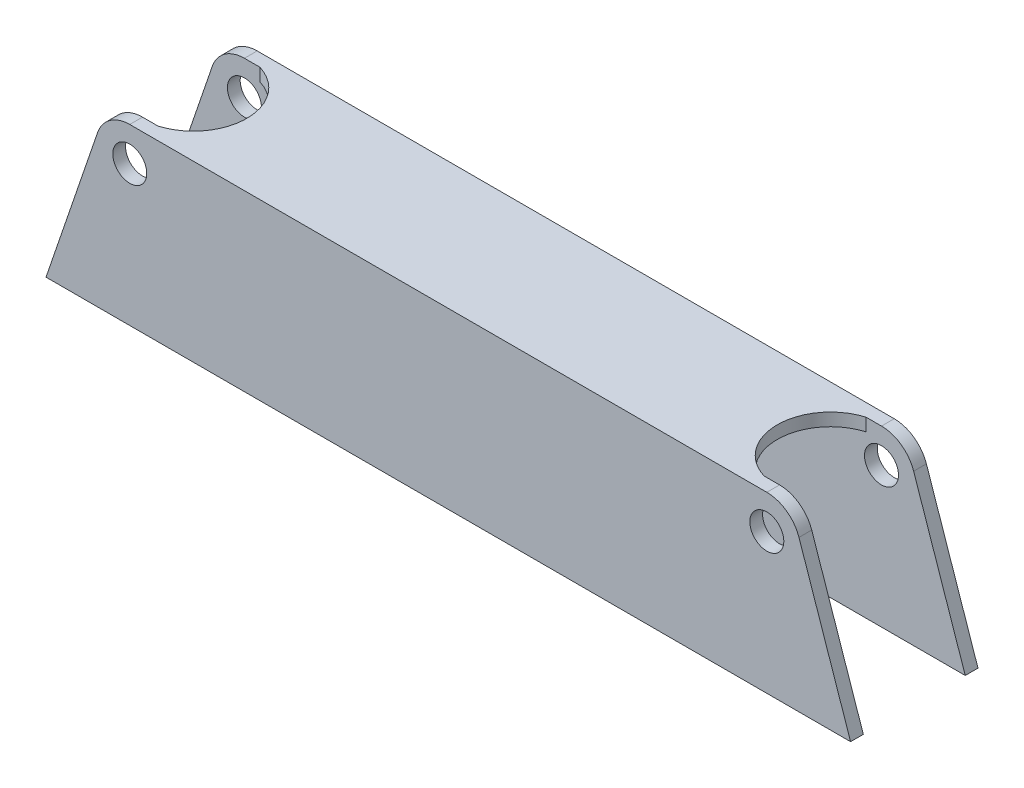
from build123d import *

# Parameters (mm, degrees)
BOSS_EXTRUDE5_START = 348
BOSS_EXTRUDE5_DEPTH = 3
BOSS_EXTRUDE6_START = -12
F_3DSKETCH1_R       = 4
BOSS_EXTRUDE6_DEPTH = 3


# Read off the part's stored shape, not the designer's step: Boss-Extrude5
with BuildPart() as part:
    # Boss-Extrude5 outline → Boss-Extrude5 (new body)
    with BuildSketch(Plane(origin=(0, 0, 0), x_dir=(1, 0, 0), z_dir=(0, 1, 0)).offset(BOSS_EXTRUDE5_START)):
        with BuildLine():
            ThreePointArc((-75, 2127.541936718), (-62.458063282, 2115), (-75, 2102.458063282))
            Line((-75, 2102.458063282), (75, 2102.458063282))
            ThreePointArc((75, 2102.458063282), (62.458063282, 2115), (75, 2127.541936718))
            Line((75, 2127.541936718), (-75, 2127.541936718))
        make_face()
    extrude(amount=BOSS_EXTRUDE5_DEPTH)

    # 3DSketch1 → Boss-Extrude6 (add)
    with BuildSketch(Plane(origin=(-82.570684984, 345.585484263, -2115), x_dir=(0.9804457750026082, -0.19678943640230048, 0), z_dir=(0, 0, -1)).offset(BOSS_EXTRUDE6_START)):
        with BuildLine():
            Line((0, 0), (-4.912403262, 37.281198271))
            Line((-4.912403262, 37.281198271), (180.830256509, 0))
            Line((180.830256509, 0), (161.912158463, -32.498077123))
            ThreePointArc((161.912158463, -32.498077123), (158.280606568, -35.768969819), (153.423992856, -36.31688537))
            Line((153.423992856, -36.31688537), (6.357126606, -6.798469909))
            ThreePointArc((6.357126606, -6.798469909), (2.088099295, -4.418908183), (0, 0))
        make_face()
        with Locations(Location((7.931442097, 1.045096291, 0), (0, 0, 348.650723519))):
            Circle(F_3DSKETCH1_R, mode=Mode.SUBTRACT)
        with Locations(Location((154.998308348, -28.47331917, 0), (0, 0, 348.650723519))):
            Circle(F_3DSKETCH1_R, mode=Mode.SUBTRACT)
    extrude(amount=-BOSS_EXTRUDE6_DEPTH)

    # Mirror4: part across plane


with BuildPart() as part_1:
    add(part.part)
    add(part.part.mirror(Plane.XY.offset(-2115)))


solid = part_1.part
